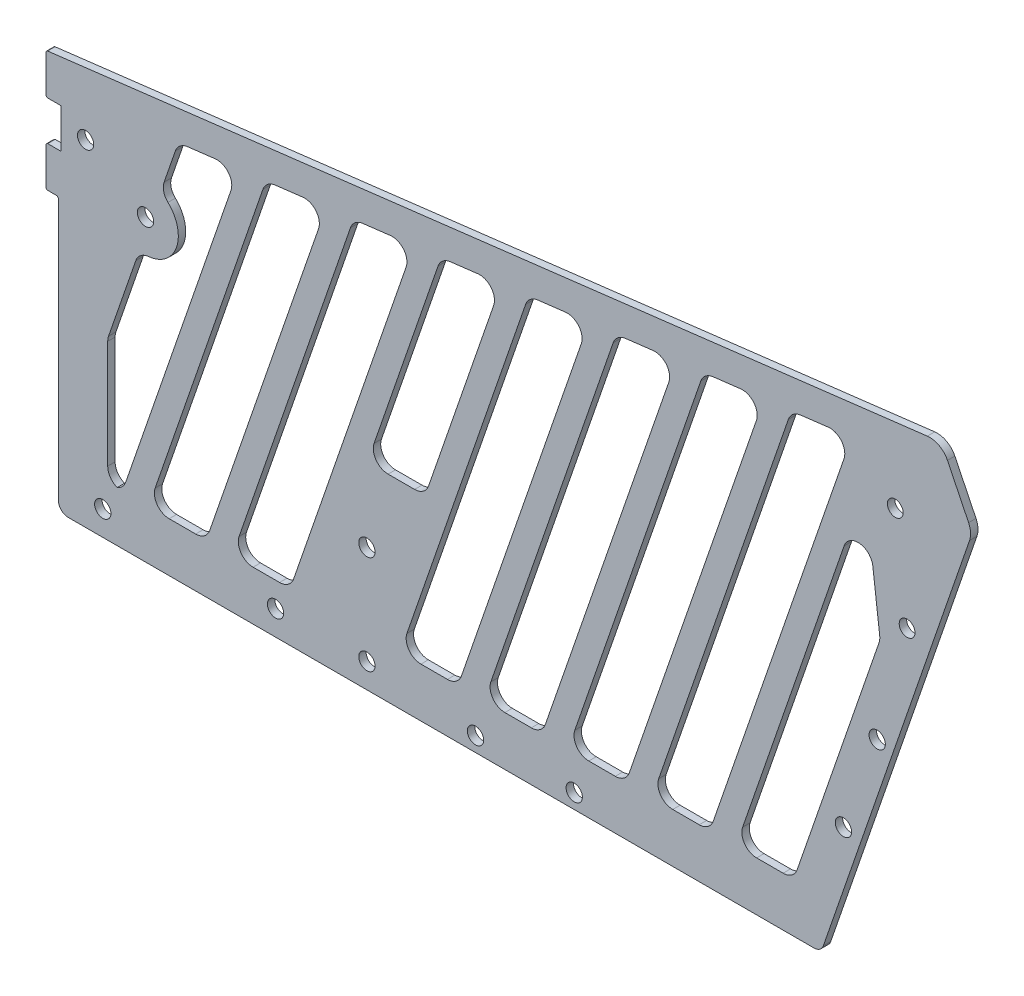
from build123d import *

# Parameters (mm, degrees)
SKETCH_1_R          = 1.65
EXTRUDE_1_DEPTH     = 1.5
SKETCH_2_R          = 1.65
CUT_EXTRUDE_1_DEPTH = 217.113258134
SKETCH_5_R          = 1.6
CUT_EXTRUDE_3_DEPTH = 217.113258134
CUT_EXTRUDE_4_DEPTH = 10
FILLET_3_R          = 3
FILLET_4_R          = 5
SKETCH_7_W          = 17
SKETCH_7_H          = 10
EXTRUDE_2_DEPTH     = 1.5
FILLET_5_R          = 3
FILLET_7_R          = 2
CHAMFER_1_SIZE      = 15
CHAMFER_1_SIZE2     = 11.223480876
FILLET_8_R          = 4
SKETCH_9_W          = 1
SKETCH_9_H          = 8
CUT_EXTRUDE_5_DEPTH = 10
SKETCH_10_W         = 2.5
SKETCH_10_H         = 8.1977715
EXTRUDE_3_DEPTH     = 1.5
FILLET_9_R          = 0.4


with BuildPart() as part:
    # 草图1 → 凸台-拉伸1 (new body)
    with BuildSketch(Plane.XY):
        Polygon((0, 0), (49, 0), (154.500036, 0), (190, 102.969366032), (0, 80), align=None)
        with Locations((44, 5)):
            Circle(SKETCH_1_R, mode=Mode.SUBTRACT)
        with Locations((9, 5)):
            Circle(SKETCH_1_R, mode=Mode.SUBTRACT)
        with Locations((62.500036, 5)):
            Circle(SKETCH_1_R, mode=Mode.SUBTRACT)
        with Locations((62.500036, 25)):
            Circle(SKETCH_1_R, mode=Mode.SUBTRACT)
        with Locations((84.500036, 3)):
            Circle(SKETCH_1_R, mode=Mode.SUBTRACT)
        with Locations((104.500036, 3)):
            Circle(SKETCH_1_R, mode=Mode.SUBTRACT)
        with Locations((159.029214579, 24.172402674)):
            Circle(SKETCH_1_R, mode=Mode.SUBTRACT)
        with Locations((165.869617446, 42.96625509)):
            Circle(SKETCH_1_R, mode=Mode.SUBTRACT)
        with Locations((5.51669804, 68)):
            Circle(SKETCH_1_R, mode=Mode.SUBTRACT)
    extrude(amount=EXTRUDE_1_DEPTH)

    # 草图2 → 切除-拉伸1 (cut, through all)
    with BuildSketch(Plane(origin=(0, 0, 0), x_dir=(-1, 0, 0), z_dir=(0, 0, -1))):
        with Locations((-17.654838092, 60.522562577)):
            Circle(SKETCH_2_R)
    extrude(amount=-CUT_EXTRUDE_1_DEPTH, mode=Mode.SUBTRACT)

    # 草图5 → 切除-拉伸3 (cut, through all)
    with BuildSketch(Plane.XY.offset(1.5)):
        with Locations((169.526207601, 85.385047705)):
            Circle(SKETCH_5_R)
        with Locations((171.926558982, 65.529612347)):
            Circle(SKETCH_5_R)
    extrude(amount=-CUT_EXTRUDE_3_DEPTH, mode=Mode.SUBTRACT)

    # 草图6 → 切除-拉伸4 (cut)
    with BuildSketch(Plane(origin=(0, 0, 0), x_dir=(-1, 0, 0), z_dir=(0, 0, -1))):
        Polygon((-166.458788313, 60.765712768), (-148.956680209, 10), (-137.24549175, 10), (-163.418370686, 85.91570378), align=None)
        Polygon((-160.704378524, 93.384092174), (-131.956680209, 10), (-120.24549175, 10), (-148.483853144, 91.90673575), align=None)
        Polygon((-142.96502336, 91.23955669), (-114.956680209, 10), (-103.24549175, 10), (-130.74449798, 89.762200266), align=None)
        Polygon((-125.225668197, 89.095021206), (-97.956680209, 10), (-86.24549175, 10), (-113.005142817, 87.617664782), align=None)
        Polygon((-107.486313033, 86.950485723), (-80.956680209, 10), (-69.24549175, 10), (-95.265787653, 85.473129299), align=None)
        with BuildLine():
            Line((-77.526432489, 83.328593815), (-89.746957869, 84.805950239))
            Line((-89.746957869, 84.805950239), (-69.149740199, 25.062722173))
            ThreePointArc((-69.149740199, 25.062722173), (-65.935444688, 30.69389736), (-59.455145067, 30.91194885))
            Line((-59.455145067, 30.91194885), (-77.526432489, 83.328593815))
        make_face()
        with BuildLine():
            Line((-12.956680209, 10), (-10, 10))
            Line((-10, 10), (-10, 35.392875452))
            Line((-10, 35.392875452), (-16.411528112, 53.989823466))
            ThreePointArc((-16.411528112, 53.989823466), (-23.94169474, 58.355090898), (-20.701647581, 66.4335229))
            Line((-20.701647581, 66.4335229), (-24.308366998, 76.894987363))
            Line((-24.308366998, 76.894987363), (-36.528892378, 78.372343787))
            Line((-36.528892378, 78.372343787), (-12.956680209, 10))
        make_face()
        Polygon((-72.007602706, 82.661414755), (-46.956680209, 10), (-35.24549175, 10), (-59.787077326, 81.184058331), align=None)
        Polygon((-29.956680209, 10), (-18.24549175, 10), (-42.047722162, 79.039522847), (-54.268247542, 80.516879271), align=None)
    extrude(amount=-CUT_EXTRUDE_4_DEPTH, mode=Mode.SUBTRACT)

    # 圆角3
    # the kernel refuses this fillet: 3 mm, written as the material it adds along each edge
    with BuildSketch(Plane(origin=(89.746957869, 84.805950239, 0), x_dir=(-0.32593559085415924, -0.9453919772319576, 0), z_dir=(0, 0, 1)), Plane(origin=(107.486313033, 86.950485723, 0), x_dir=(-0.32593559085416013, -0.9453919772319572, 0), z_dir=(0, 0, 1)), Plane(origin=(54.268247542, 80.516879271, 0), x_dir=(-0.32593559085415885, -0.9453919772319577, 0), z_dir=(0, 0, 1)), Plane(origin=(125.225668197, 89.095021206, 0), x_dir=(-0.32593559085416013, -0.9453919772319572, 0), z_dir=(0, 0, 1)), Plane(origin=(142.96502336, 91.23955669, 0), x_dir=(-0.3259355908541637, -0.945391977231956, 0), z_dir=(0, 0, 1)), Plane(origin=(36.528892378, 78.372343787, 0), x_dir=(-0.32593559085416013, -0.9453919772319572, 0), z_dir=(0, 0, 1))) as fillet_3_piece_1:
        with BuildLine():
            CenterArc((FILLET_3_R * 1.59770807733, -FILLET_3_R), FILLET_3_R, 90, 115.915383649)
            Line((FILLET_3_R * 0.698267610033, -FILLET_3_R * 1.43704329967), (0, 0))
            Line((0, 0), (FILLET_3_R * 1.59770807733, 0))
        make_face()
    extrude(amount=1.5)
    with BuildSketch(Plane(origin=(77.526432489, 83.328593815, 0), x_dir=(-0.32593559085416024, -0.9453919772319572, 0), z_dir=(0, 0, 1))) as fillet_3_piece_2:
        with BuildLine():
            CenterArc((FILLET_3_R * 0.625896566582, FILLET_3_R), FILLET_3_R, 205.915383649, 64.084616351)
            Line((-FILLET_3_R * 0.273543900714, FILLET_3_R * 0.562956700325), (0, 0))
            Line((0, 0), (FILLET_3_R * 0.625896566582, 0))
        make_face()
    extrude(amount=1.5)
    with BuildSketch(Plane(origin=(95.265787653, 85.473129299, 0), x_dir=(0.9927717678876198, 0.12001756906924078, 0), z_dir=(0, 0, 1)), Plane(origin=(42.047722162, 79.039522847, 0), x_dir=(0.9927717678876197, 0.12001756906924214, 0), z_dir=(0, 0, 1)), Plane(origin=(59.787077326, 81.184058331, 0), x_dir=(0.9927717678876204, 0.12001756906923514, 0), z_dir=(0, 0, 1)), Plane(origin=(148.483853144, 91.90673575, 0), x_dir=(0.9927717678876198, 0.12001756906924078, 0), z_dir=(0, 0, 1)), Plane(origin=(113.005142817, 87.617664782, 0), x_dir=(0.9927717678876197, 0.12001756906924169, 0), z_dir=(0, 0, 1)), Plane(origin=(130.74449798, 89.762200266, 0), x_dir=(0.9927717678876193, 0.1200175690692444, 0), z_dir=(0, 0, 1)), Plane(origin=(24.308366998, 76.894987363, 0), x_dir=(0.9927717678876197, 0.12001756906924214, 0), z_dir=(0, 0, 1))) as fillet_3_piece_3:
        with BuildLine():
            CenterArc((FILLET_3_R * 0.625896566582, -FILLET_3_R), FILLET_3_R, 90, 64.084616351)
            Line((-FILLET_3_R * 0.273543900714, -FILLET_3_R * 0.562956700325), (0, 0))
            Line((0, 0), (FILLET_3_R * 0.625896566582, 0))
        make_face()
    extrude(amount=1.5)
    with BuildSketch(Plane(origin=(69.24549175, 10, 0), x_dir=(0.3259355908541607, 0.9453919772319569, 0), z_dir=(0, 0, 1)), Plane(origin=(35.24549175, 10, 0), x_dir=(0.3259355908541611, 0.9453919772319569, 0), z_dir=(0, 0, 1)), Plane(origin=(120.24549175, 10, 0), x_dir=(0.3259355908541582, 0.9453919772319579, 0), z_dir=(0, 0, 1)), Plane(origin=(137.24549175, 10, 0), x_dir=(0.3259355908541602, 0.9453919772319572, 0), z_dir=(0, 0, 1)), Plane(origin=(86.24549175, 10, 0), x_dir=(0.3259355908541607, 0.9453919772319569, 0), z_dir=(0, 0, 1)), Plane(origin=(103.24549175, 10, 0), x_dir=(0.3259355908541607, 0.9453919772319569, 0), z_dir=(0, 0, 1))) as fillet_3_piece_4:
        with BuildLine():
            CenterArc((FILLET_3_R * 1.40252469112, -FILLET_3_R), FILLET_3_R, 90, 109.022267108)
            Line((FILLET_3_R * 0.457132713888, -FILLET_3_R * 1.32593559085), (0, 0))
            Line((0, 0), (FILLET_3_R * 1.40252469112, 0))
        make_face()
    extrude(amount=1.5)
    with BuildSketch(Plane(origin=(80.956680209, 10, 0), x_dir=(0.32593559085415746, 0.9453919772319582, 0), z_dir=(0, 0, 1)), Plane(origin=(97.956680209, 10, 0), x_dir=(0.32593559085415946, 0.9453919772319574, 0), z_dir=(0, 0, 1)), Plane(origin=(114.956680209, 10, 0), x_dir=(0.3259355908541564, 0.9453919772319586, 0), z_dir=(0, 0, 1)), Plane(origin=(12.956680209, 10, 0), x_dir=(0.3259355908541589, 0.9453919772319578, 0), z_dir=(0, 0, 1))) as fillet_3_piece_5:
        with BuildLine():
            CenterArc((FILLET_3_R * 0.7129999253, FILLET_3_R), FILLET_3_R, 199.022267108, 70.977732892)
            Line((-FILLET_3_R * 0.232392051932, FILLET_3_R * 0.674064409146), (0, 0))
            Line((0, 0), (FILLET_3_R * 0.7129999253, 0))
        make_face()
    extrude(amount=1.5)
    with BuildSketch(Plane(origin=(18.24549175, 10, 0), x_dir=(1, 0, 0), z_dir=(0, 0, 1))) as fillet_3_piece_6:
        with BuildLine():
            CenterArc((FILLET_3_R * 1.40252469112, FILLET_3_R), FILLET_3_R, 160.977732892, 109.022267108)
            Line((FILLET_3_R * 0.457132713888, FILLET_3_R * 1.32593559085), (0, 0))
            Line((0, 0), (FILLET_3_R * 1.40252469112, 0))
        make_face()
    extrude(amount=1.5)
    with BuildSketch(Plane(origin=(29.956680209, 10, 0), x_dir=(-1, 0, 0), z_dir=(0, 0, 1)), Plane(origin=(46.956680209, 10, 0), x_dir=(-1, 0, 0), z_dir=(0, 0, 1)), Plane(origin=(131.956680209, 10, 0), x_dir=(-1, 0, 0), z_dir=(0, 0, 1)), Plane(origin=(148.956680209, 10, 0), x_dir=(-1, 0, 0), z_dir=(0, 0, 1))) as fillet_3_piece_7:
        with BuildLine():
            CenterArc((FILLET_3_R * 0.7129999253, -FILLET_3_R), FILLET_3_R, 90, 70.977732892)
            Line((-FILLET_3_R * 0.232392051932, -FILLET_3_R * 0.674064409146), (0, 0))
            Line((0, 0), (FILLET_3_R * 0.7129999253, 0))
        make_face()
    extrude(amount=1.5)
    with BuildSketch(Plane(origin=(72.007602706, 82.661414755, 0), x_dir=(-0.9927717678876198, -0.12001756906924071, 0), z_dir=(0, 0, 1)), Plane(origin=(160.704378524, 93.384092174, 0), x_dir=(-0.9927717678876197, -0.12001756906924108, 0), z_dir=(0, 0, 1))) as fillet_3_piece_8:
        with BuildLine():
            CenterArc((FILLET_3_R * 1.59770807733, FILLET_3_R), FILLET_3_R, 154.084616351, 115.915383649)
            Line((FILLET_3_R * 0.698267610033, FILLET_3_R * 1.43704329967), (0, 0))
            Line((0, 0), (FILLET_3_R * 1.59770807733, 0))
        make_face()
    extrude(amount=1.5)
    with BuildSketch(Plane(origin=(166.458788313, 60.765712768, 0), x_dir=(-0.3259355908541462, -0.9453919772319621, 0), z_dir=(0, 0, 1))) as fillet_3_piece_9:
        with BuildLine():
            CenterArc((FILLET_3_R * 0.230090548875, -FILLET_3_R), FILLET_3_R, 90, 25.915383649)
            Line((-FILLET_3_R * 0.2069527508, -FILLET_3_R * 0.100559532704), (0, 0))
            Line((0, 0), (FILLET_3_R * 0.230090548875, 0))
        make_face()
    extrude(amount=1.5)
    with BuildSketch(Plane(origin=(163.418370686, 85.91570378, 0), x_dir=(-0.3259355908541588, -0.9453919772319578, 0), z_dir=(0, 0, 1))) as fillet_3_piece_10:
        with BuildLine():
            CenterArc((FILLET_3_R * 4.34611506162, FILLET_3_R), FILLET_3_R, 115.915383649, 154.084616351)
            Line((FILLET_3_R * 3.90907176194, FILLET_3_R * 1.8994404673), (0, 0))
            Line((0, 0), (FILLET_3_R * 4.34611506162, 0))
        make_face()
    extrude(amount=1.5)
    with BuildSketch(Plane(origin=(20.701647581, 66.4335229, 0), x_dir=(0.3259355908541343, 0.9453919772319662, 0), z_dir=(0, 0, 1))) as fillet_3_piece_11:
        with BuildLine():
            CenterArc((2.221583802, -3), FILLET_3_R, 90, 65.812499939)
            ThreePointArc((-0.515044774, -1.770827906), (-0.195837699, -0.903354926), (0, 0))
            Line((0, 0), (2.221583802, 0))
        make_face()
    extrude(amount=1.5)
    with BuildSketch(Plane(origin=(16.411528112, 53.989823466, 0), x_dir=(0.9988016907645847, -0.04894060201720955, 0), z_dir=(0, 0, 1))) as fillet_3_piece_12:
        with BuildLine():
            CenterArc((2.260194582, -2.971019192), FILLET_3_R, 97.970443489, 65.812499939)
            Line((-0.620437185, -2.133188292), (0, 0))
            ThreePointArc((0, 0), (0.922103925, -0.064240792), (1.84420785, 0))
        make_face()
    extrude(amount=1.5)
    with BuildSketch(Plane(origin=(10, 35.392875452, 0), x_dir=(0.3259355908541632, 0.9453919772319561, 0), z_dir=(0, 0, 1))) as fillet_3_piece_13:
        with BuildLine():
            CenterArc((FILLET_3_R * 0.167542374323, -FILLET_3_R), FILLET_3_R, 90, 19.022267108)
            Line((-FILLET_3_R * 0.158393216531, -FILLET_3_R * 0.054608022768), (0, 0))
            Line((0, 0), (FILLET_3_R * 0.167542374323, 0))
        make_face()
    extrude(amount=1.5)
    with BuildSketch(Plane(origin=(10, 10, 0), x_dir=(0, 1, 0), z_dir=(0, 0, 1))) as fillet_3_piece_14:
        with BuildLine():
            CenterArc((FILLET_3_R, -FILLET_3_R), FILLET_3_R, 90, 90)
            Line((0, -FILLET_3_R), (0, 0))
            Line((0, 0), (FILLET_3_R, 0))
        make_face()
    extrude(amount=1.5)

    # 圆角4
    fillet_4_edges = [part.edges().sort_by_distance(p)[0] for p in [
        (69.149740199, 25.062722173, 0.75),
    ]]
    fillet(fillet_4_edges, radius=FILLET_4_R)

    # 草图7 → 凸台-拉伸2 (add)
    with BuildSketch(Plane.XY.offset(1.5)):
        with Locations((67.640739409, 35)):
            Rectangle(SKETCH_7_W, SKETCH_7_H)
    extrude(amount=-EXTRUDE_2_DEPTH)

    # 圆角5
    fillet_5_edges = [part.edges().sort_by_distance(p)[0] for p in [
        (62.588363238, 40, 0.75),
        (74.299551697, 40, 0.75),
    ]]
    fillet(fillet_5_edges, radius=FILLET_5_R)

    # 圆角7
    fillet_7_edges = [part.edges().sort_by_distance(p)[0] for p in [
        (0, 80, 0.75),
        (154.500036, 0, 0.75),
        (0, 0, 0.75),
    ]]
    fillet(fillet_7_edges, radius=FILLET_7_R)

    # 倒角1
    chamfer_1_edges = [part.edges().sort_by_distance(p)[0] for p in [
        (190, 102.969366032, 0.75),
    ]]
    chamfer_1_side = [part.faces().sort_by_distance(p)[0] for p in [
        (172.482410052, 52.158747425, 0.75),
    ]]
    chamfer(chamfer_1_edges, length=CHAMFER_1_SIZE, length2=CHAMFER_1_SIZE2, reference=chamfer_1_side[0])

    # 圆角8
    fillet_8_edges = [part.edges().sort_by_distance(p)[0] for p in [
        (178.857645049, 101.622351141, 0.75),
        (185.110966137, 88.788486374, 0.75),
    ]]
    fillet(fillet_8_edges, radius=FILLET_8_R)

    # 草图9 → 切除-拉伸5 (cut)
    with BuildSketch(Plane.XY.offset(1.5)):
        with Locations((0, 67.5)):
            Rectangle(SKETCH_9_W, SKETCH_9_H)
    extrude(amount=-CUT_EXTRUDE_5_DEPTH, mode=Mode.SUBTRACT)

    # 草图10 → 凸台-拉伸3 (add)
    with BuildSketch(Plane.XY.offset(1.5)):
        with BuildLine():
            Line((1.759964862, 80.212764616), (-2.5, 79.6977715))
            Line((-2.5, 79.6977715), (-2.5, 71.5))
            Line((-2.5, 71.5), (0, 71.5))
            Line((0, 71.5), (0, 78.227221081))
            ThreePointArc((0, 78.227221081), (0.503325307, 79.553857754), (1.759964862, 80.212764616))
        make_face()
        with Locations((-1.25, 59.40111425)):
            Rectangle(SKETCH_10_W, SKETCH_10_H)
    extrude(amount=-EXTRUDE_3_DEPTH)

    # 圆角9
    fillet_9_edges = [part.edges().sort_by_distance(p)[0] for p in [
        (-2.5, 79.6977715, 0.75),
        (-2.5, 71.5, 0.75),
        (-2.5, 63.5, 0.75),
        (-2.5, 55.3022285, 0.75),
        (0, 55.3022285, 0.75),
    ]]
    fillet(fillet_9_edges, radius=FILLET_9_R)


solid = part.part
